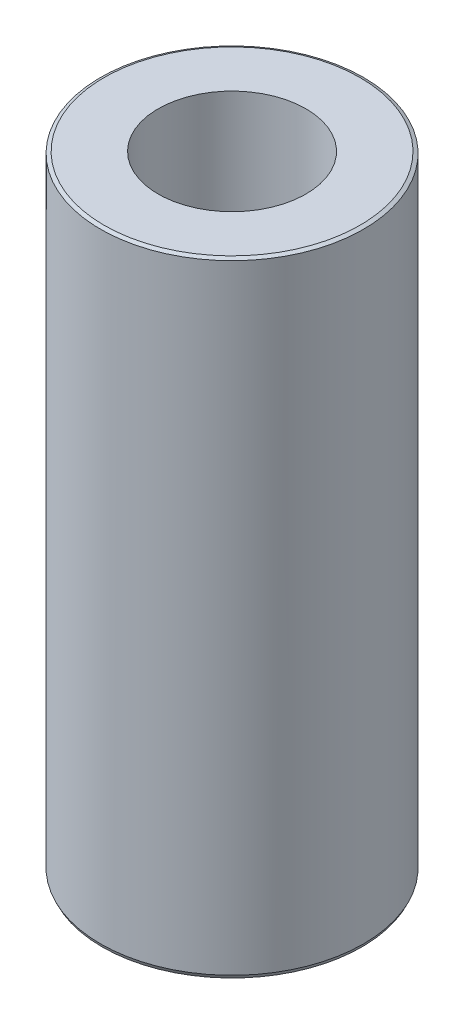
from build123d import *
from OCP.BRepFilletAPI import BRepFilletAPI_MakeChamfer

# Parameters (mm, degrees)
SKETCH1_R           = 50
BOSS_EXTRUDE1_DEPTH = 237.249576593
SKETCH2_R           = 28.094408284
CUT_EXTRUDE1_DEPTH  = 248.562843726
CHAMFER1_SIZE       = 0.631218748
CHAMFER1_SIZE2      = 1.351532755


with BuildPart() as part:
    # Sketch1 → Boss-Extrude1 (new body)
    with BuildSketch(Plane(origin=(0, 0, 0), x_dir=(1, 0, 0), z_dir=(0, 1, 0))):
        Circle(SKETCH1_R)
    extrude(amount=BOSS_EXTRUDE1_DEPTH)

    # Sketch2 → Cut-Extrude1 (cut, through all)
    with BuildSketch(Plane(origin=(0, 0, 0), x_dir=(1, 0, 0), z_dir=(0, 1, 0))):
        Circle(SKETCH2_R)
    extrude(amount=CUT_EXTRUDE1_DEPTH, mode=Mode.SUBTRACT)

    # Chamfer1: one chamfer whose edges measure the first distance from different faces: ONE call of the kernel's chamfer builder (chamfer() names one face for all edges)
    chamfer1_edges_1 = [part.edges().sort_by_distance(p)[0] for p in [
        (-50, 237.249576593, 0),
    ]]
    chamfer1_side_1 = [part.faces().sort_by_distance(p)[0] for p in [
        (-50, 118.624788297, 0),
    ]]
    chamfer1_edges_2 = [part.edges().sort_by_distance(p)[0] for p in [
        (-50, 0, 0),
    ]]
    chamfer1_side_2 = [part.faces().sort_by_distance(p)[0] for p in [
        (-48.585786438, 0, 0),
    ]]
    chamfer1 = BRepFilletAPI_MakeChamfer(part.part.solid().wrapped)
    for e in chamfer1_edges_1:
        chamfer1.Add(CHAMFER1_SIZE, CHAMFER1_SIZE2, e.wrapped, chamfer1_side_1[0].wrapped)  # the first distance lies on this face
    for e in chamfer1_edges_2:
        chamfer1.Add(CHAMFER1_SIZE, CHAMFER1_SIZE2, e.wrapped, chamfer1_side_2[0].wrapped)  # the first distance lies on this face
    add(Compound.cast(chamfer1.Shape()), mode=Mode.REPLACE)


solid = part.part
